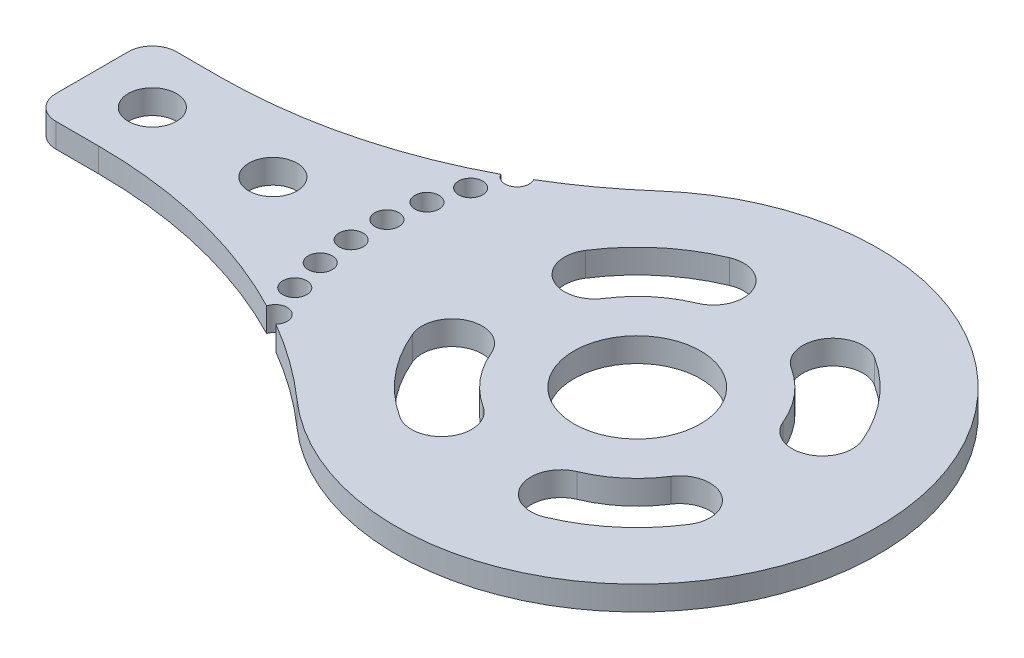
from build123d import *

# Parameters (mm, degrees)
EXTRUDE_1_DEPTH          = 2
SKETCH_2_R               = 1
CUT_EXTRUDE_1_DEPTH      = 70.884123245
PATTERN_CIRCULAR_1_COUNT = 8
PATTERN_CIRCULAR_1_ANGLE = 52.5
SKETCH_3_R               = 2
CUT_EXTRUDE_2_DEPTH      = 70.884123245
PATTERN_LINEAR_1_COUNT   = 2
PATTERN_LINEAR_1_PITCH   = 10
CUT_EXTRUDE_4_DEPTH      = 70.884123245
PATTERN_CIRCULAR_3_COUNT = 4
SKETCH_7_R               = 5.25
CUT_EXTRUDE_5_DEPTH      = 70.884123245


with BuildPart() as part:
    # Эскиз1 → Бобышка-Вытянуть1 (new body)
    with BuildSketch(Plane(origin=(0, 0, 0), x_dir=(1, 0, 0), z_dir=(0, 1, 0))):
        with BuildLine():
            Line((0, -2), (0, -8))
            ThreePointArc((0, -8), (0.585786438, -9.414213562), (2, -10))
            Line((2, -10), (5.542486889, -10))
            ThreePointArc((5.542486889, -10), (19.684622513, -12.583426132), (32, -20))
            ThreePointArc((32, -20), (65.228756555, -5), (32, 10))
            ThreePointArc((32, 10), (19.684622513, 2.583426132), (5.542486889, 0))
            Line((5.542486889, 0), (2, 0))
            ThreePointArc((2, 0), (0.585786438, -0.585786438), (0, -2))
        make_face()
    extrude(amount=EXTRUDE_1_DEPTH)

    # Эскиз2 → Вырез-Вытянуть1 (cut, through all)
    with BuildSketch(Plane(origin=(0, 2, 0), x_dir=(1, 0, 0), z_dir=(0, 1, 0))):
        with Locations((25.137189268, 5.128125392)):
            Circle(SKETCH_2_R)
    cut_extrude_1 = extrude(amount=-CUT_EXTRUDE_1_DEPTH, mode=Mode.SUBTRACT)

    # Круговой массив1: Вырез-Вытянуть1 ×8 about axis
    pattern_circular_1_axis = Axis((45.228756555, 2, 5), (0, 1, 0))
    for i in range(1, PATTERN_CIRCULAR_1_COUNT):
        add(cut_extrude_1.rotate(pattern_circular_1_axis, i * PATTERN_CIRCULAR_1_ANGLE / (PATTERN_CIRCULAR_1_COUNT - 1)), mode=Mode.SUBTRACT)

    # Эскиз3 → Вырез-Вытянуть2 (cut, through all)
    with BuildSketch(Plane(origin=(0, 2, 0), x_dir=(1, 0, 0), z_dir=(0, 1, 0))):
        with Locations((5, -5)):
            Circle(SKETCH_3_R)
    cut_extrude_2 = extrude(amount=-CUT_EXTRUDE_2_DEPTH, mode=Mode.SUBTRACT)

    # Линейный массив1: Вырез-Вытянуть2 ×2
    with Locations(*[(i * PATTERN_LINEAR_1_PITCH, 0, 0) for i in range(1, PATTERN_LINEAR_1_COUNT)]):
        add(cut_extrude_2, mode=Mode.SUBTRACT)

    # Эскиз6 → Вырез-Вытянуть4 (cut, through all)
    with BuildSketch(Plane(origin=(0, 2, 0), x_dir=(1, 0, 0), z_dir=(0, 1, 0))):
        with BuildLine():
            ThreePointArc((37.446222009, -0.000750623), (39.288664725, 2.090532233), (41.67041088, 3.538062681))
            ThreePointArc((41.67041088, 3.538062681), (43.016297342, 6.807403537), (39.746956487, 8.153289999))
            ThreePointArc((39.746956487, 8.153289999), (36.077763715, 5.923300776), (33.239393437, 2.701580475))
            ThreePointArc((33.239393437, 2.701580475), (33.991642174, -0.75299936), (37.446222009, -0.000750623))
        make_face()
    cut_extrude_4 = extrude(amount=-CUT_EXTRUDE_4_DEPTH, mode=Mode.SUBTRACT)

    # Круговой массив3: Вырез-Вытянуть4 ×4 about axis
    pattern_circular_3_axis = Axis((45.228756555, 2, 5), (0, 1, 0))
    for i in range(1, PATTERN_CIRCULAR_3_COUNT):
        add(cut_extrude_4.rotate(pattern_circular_3_axis, i * 360 / PATTERN_CIRCULAR_3_COUNT), mode=Mode.SUBTRACT)

    # Эскиз7 → Вырез-Вытянуть5 (cut, through all)
    with BuildSketch(Plane(origin=(0, 2, 0), x_dir=(1, 0, 0), z_dir=(0, 1, 0))):
        with Locations((45.228756555, -5)):
            Circle(SKETCH_7_R)
    extrude(amount=-CUT_EXTRUDE_5_DEPTH, mode=Mode.SUBTRACT)


solid = part.part
